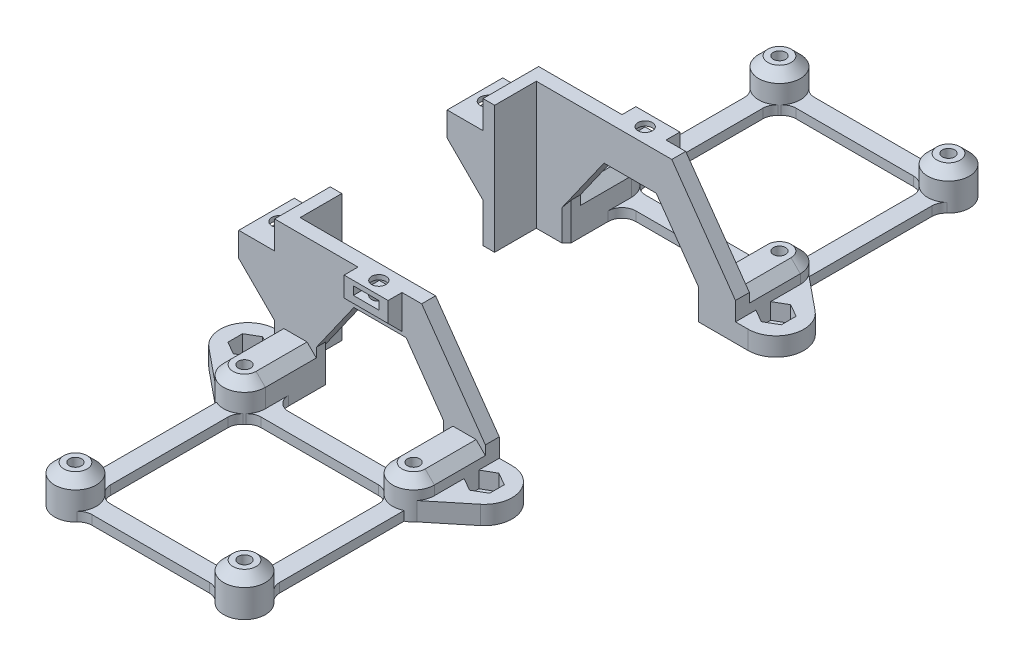
from build123d import *

# Parameters (mm, degrees)
SKETCH1_R             = 4.5
SKETCH1_R_2           = 1.325
BOSS_EXTRUDE1_DEPTH   = 8
BOSS_EXTRUDE1_2_DEPTH = 8
BOSS_EXTRUDE1_3_DEPTH = 8
BOSS_EXTRUDE1_4_DEPTH = 8
BOSS_EXTRUDE2_REACH   = 94.814
SKETCH2_W             = 3
SKETCH2_H             = 27.5
CUT_EXTRUDE1_DEPTH    = 64.069901696
SKETCH4_W             = 40.5
SKETCH4_H             = 40.5
SKETCH4_W_2           = 32.5
SKETCH4_H_2           = 32.5
BOSS_EXTRUDE3_DEPTH   = 2
SKETCH7_W             = 9.5
SKETCH7_H             = 3
BOSS_EXTRUDE5_DEPTH   = 4.3
CUT_EXTRUDE3_START    = -1
SKETCH8_W             = 5.5
SKETCH8_H             = 5.5
CUT_EXTRUDE3_DEPTH    = 1.8
CHAMFER3_SIZE         = 3
SKETCH9_R             = 1.55
CUT_EXTRUDE4_DEPTH    = 5.4
BOSS_EXTRUDE6_DEPTH   = 4
SKETCH11_R            = 1.5
BOSS_EXTRUDE7_DEPTH   = 0.5
FILLET2_R             = 3
CHAMFER4_SIZE         = 1
SKETCH12_W            = 2.5
SKETCH12_H            = 27.5
BOSS_EXTRUDE8_DEPTH   = 9
CHAMFER5_SIZE         = 2
SKETCH13_W            = 7.75
SKETCH13_H            = 12
BOSS_EXTRUDE9_DEPTH   = 5
CUT_EXTRUDE5_START    = -1
SKETCH14_W            = 5.5
SKETCH14_H            = 5.5
CUT_EXTRUDE5_DEPTH    = 1.8
CHAMFER6_SIZE         = 8
CHAMFER7_SIZE         = 8
SKETCH15_R            = 1.6
CUT_EXTRUDE6_DEPTH    = 12
SKETCH17_W            = 5.5
SKETCH17_H            = 1.8
CUT_EXTRUDE8_DEPTH    = 5.6
SKETCH18_W            = 5.5
SKETCH18_H            = 1.8
CUT_EXTRUDE9_DEPTH    = 5.6
SKETCH19_W            = 5.5
SKETCH19_H            = 1.8
CUT_EXTRUDE10_DEPTH   = 5.6
SKETCH20_W            = 5.5
SKETCH20_H            = 1.8
CUT_EXTRUDE11_DEPTH   = 5.6


# Some blends are built 0.0001 mm under size
with BuildPart() as part:
    # Sketch1 → Boss-Extrude1 (new body)
    with BuildSketch(Plane(origin=(0, 0, 0), x_dir=(1, 0, 0), z_dir=(0, 1, 0))):
        with Locations(Location((18.25, -76, 0), (0, 0, 270))):
            Circle(SKETCH1_R)
        with Locations(Location((18.25, -76, 0), (0, 0, 270))):
            Circle(SKETCH1_R_2, mode=Mode.SUBTRACT)
    extrude(amount=BOSS_EXTRUDE1_DEPTH)



with BuildPart() as body_2:
    # Sketch1 → Boss-Extrude1 2 (new body)
    with BuildSketch(Plane(origin=(0, 0, 0), x_dir=(1, 0, 0), z_dir=(0, 1, 0))):
        with Locations(Location((-18.25, -76, 0), (0, 0, 270))):
            Circle(SKETCH1_R)
        with Locations(Location((-18.25, -76, 0), (0, 0, 270))):
            Circle(SKETCH1_R_2, mode=Mode.SUBTRACT)
    extrude(amount=BOSS_EXTRUDE1_2_DEPTH)


with BuildPart() as body_3:
    # Sketch1 → Boss-Extrude1 3 (new body)
    with BuildSketch(Plane(origin=(0, 0, 0), x_dir=(1, 0, 0), z_dir=(0, 1, 0))):
        with BuildLine():
            Line((-22.75, -39.5), (-22.75, -25.5))
            Line((-22.75, -25.5), (-13.75, -25.5))
            Line((-13.75, -25.5), (-13.75, -39.5))
            ThreePointArc((-13.75, -39.5), (-18.25, -44), (-22.75, -39.5))
        make_face()
        with Locations(Location((-18.25, -39.5, 0), (0, 0, 270))):
            Circle(SKETCH1_R_2, mode=Mode.SUBTRACT)
    extrude(amount=BOSS_EXTRUDE1_3_DEPTH)

    # Boss-Extrude2: up to this face of the body (flat: up to its plane)
    boss_extrude2_end = Plane(body_3.part.faces().sort_by_distance((-22.75, 4, 32.5))[0])
    # Sketch2 → Boss-Extrude2 (add, up to the picked face)
    with BuildSketch(Plane(origin=(22.75, 0, 0), x_dir=(0, 0, -1), z_dir=(1, 0, 0)), mode=Mode.PRIVATE) as boss_extrude2_sk1:
        with Locations((-27, 13.75)):
            Rectangle(SKETCH2_W, SKETCH2_H)
    boss_extrude2_tool1 = split(extrude(boss_extrude2_sk1.sketch, amount=-BOSS_EXTRUDE2_REACH, mode=Mode.PRIVATE), bisect_by=boss_extrude2_end, keep=Keep.BOTH, mode=Mode.PRIVATE)


with BuildPart() as body_4:
    # Sketch1 → Boss-Extrude1 4 (new body)
    with BuildSketch(Plane(origin=(0, 0, 0), x_dir=(1, 0, 0), z_dir=(0, 1, 0))):
        with BuildLine():
            Line((22.75, -39.5), (22.75, -25.5))
            Line((22.75, -25.5), (13.75, -25.5))
            Line((13.75, -25.5), (13.75, -39.5))
            ThreePointArc((13.75, -39.5), (18.25, -44), (22.75, -39.5))
        make_face()
        with Locations(Location((18.25, -39.5, 0), (0, 0, 270))):
            Circle(SKETCH1_R_2, mode=Mode.SUBTRACT)
    extrude(amount=BOSS_EXTRUDE1_4_DEPTH)


with BuildPart() as body_3_1:
    add(body_3.part)

    add(body_4.part)  # Boss-Extrude2 merges body 4
    add(boss_extrude2_tool1.solids().sort_by(Axis((22.75, 13.75, 27), (-1, 0, 0)))[0])

    # Sketch3 → Cut-Extrude1 (cut, through all)
    with BuildSketch(Plane.XY.offset(28.5)):
        Polygon((9, 27.5), (22.75, 8), (22.75, 27.5), align=None)
        Polygon((-13.75, 8), (-13.75, 0), (13.75, 0), (13.75, 8), (5.641025641, 19.5), (-5.641025641, 19.5), align=None)
    extrude(amount=-CUT_EXTRUDE1_DEPTH, mode=Mode.SUBTRACT)


with BuildPart() as part_1:
    add(part.part)

    add(body_2.part)  # Boss-Extrude3 merges body 2

    add(body_3_1.part)  # Boss-Extrude3 merges body 3
    # Sketch4 → Boss-Extrude3 (add)
    with BuildSketch(Plane.XZ):
        with Locations((0, 57.75)):
            Rectangle(SKETCH4_W, SKETCH4_H)
        with Locations((0, 57.75)):
            Rectangle(SKETCH4_W_2, SKETCH4_H_2, mode=Mode.SUBTRACT)
    extrude(amount=-BOSS_EXTRUDE3_DEPTH)

    # Sketch7 → Boss-Extrude5 (add)
    with BuildSketch(Plane(origin=(0, 27.5, 0), x_dir=(1, 0, 0), z_dir=(0, 1, 0))):
        with Locations((0, -30)):
            Rectangle(SKETCH7_W, SKETCH7_H)
    extrude(amount=-BOSS_EXTRUDE5_DEPTH)

    # Sketch8 → Cut-Extrude3 (cut)
    with BuildSketch(Plane(origin=(0, 27.5, 0), x_dir=(1, 0, 0), z_dir=(0, 1, 0)).offset(CUT_EXTRUDE3_START)):
        with Locations((0, -28.75)):
            Rectangle(SKETCH8_W, SKETCH8_H)
    extrude(amount=-CUT_EXTRUDE3_DEPTH, mode=Mode.SUBTRACT)

    # Chamfer3
    chamfer3_edges = [part_1.edges().sort_by_distance(p)[0] for p in [
        (0, 23.2, 28.5),
    ]]
    chamfer(chamfer3_edges, length=CHAMFER3_SIZE - 0.0001)  # a hair under: the kernel refuses the full size

    # Sketch9 → Cut-Extrude4 (cut)
    with BuildSketch(Plane(origin=(0, 27.5, 0), x_dir=(1, 0, 0), z_dir=(0, 1, 0))):
        with Locations(Location((0, -28.75, 0), (0, 0, 270))):
            Circle(SKETCH9_R)
    extrude(amount=-CUT_EXTRUDE4_DEPTH, mode=Mode.SUBTRACT)

    # Sketch10 → Boss-Extrude6 (add)
    with BuildSketch(Plane.XZ):
        with BuildLine():
            Line((-22.75, 25.5), (-25.5, 25.5))
            ThreePointArc((-25.5, 25.5), (-31.151887406, 29.486006765), (-29.294287667, 36.14794375))
            Line((-29.294287667, 36.14794375), (-20.25, 43.531128874))
            Line((-20.25, 43.531128874), (-20.25, 25.5))
            Line((-20.25, 25.5), (-22.75, 25.5))
        make_face()
        Polygon((-25.5, 28.324573519), (-22.75, 29.91228676), (-22.75, 33.08771324), (-25.5, 34.675426481), (-28.25, 33.08771324), (-28.25, 29.91228676), align=None, mode=Mode.SUBTRACT)
    boss_extrude6 = extrude(amount=-BOSS_EXTRUDE6_DEPTH)

    # Sketch11 → Boss-Extrude7 (add)
    with BuildSketch(Plane.XZ):
        Polygon((-28.25, 33.08771324), (-28.25, 29.91228676), (-25.5, 28.324573519), (-22.75, 29.91228676), (-22.75, 33.08771324), (-25.5, 34.675426481), align=None)
        with Locations(Location((-25.5, 31.5, 0), (0, 0, 270))):
            Circle(SKETCH11_R, mode=Mode.SUBTRACT)
    boss_extrude7 = extrude(amount=-BOSS_EXTRUDE7_DEPTH)

    # Mirror1: Boss-Extrude6, Boss-Extrude7 across plane
    add(boss_extrude6.mirror(Plane(origin=(0, 0, 0), x_dir=(0, 0, 1), z_dir=(1, 0, 0))))
    add(boss_extrude7.mirror(Plane(origin=(0, 0, 0), x_dir=(0, 0, 1), z_dir=(1, 0, 0))))

    # Fillet2
    fillet2_edges = [part_1.edges().sort_by_distance(p)[0] for p in [
        (14.218871126, 1, 78),
        (-16.25, 1, 71.968871126),
        (-14.218871126, 1, 78),
        (-20.25, 1, 71.968871126),
        (-14.218871126, 1, 74),
        (14.218871126, 1, 41.5),
        (-14.218871126, 1, 41.5),
        (13.75, 1, 37.5),
        (-13.75, 1, 37.5),
        (16.25, 1, 71.968871126),
        (-16.25, 1, 43.531128874),
        (20.25, 1, 71.968871126),
        (16.25, 1, 43.531128874),
        (14.218871126, 1, 74),
    ]]
    fillet(fillet2_edges, radius=FILLET2_R)

    # Chamfer4
    chamfer4_edges = [part_1.edges().sort_by_distance(p)[0] for p in [
        (13.75, 4, 25.5),
        (-13.75, 4, 25.5),
    ]]
    chamfer(chamfer4_edges, length=CHAMFER4_SIZE)

    # Sketch12 → Boss-Extrude8 (add)
    with BuildSketch(Plane(origin=(0, 0, 25.5), x_dir=(-1, 0, 0), z_dir=(0, 0, -1))):
        with Locations((21.5, 13.75)):
            Rectangle(SKETCH12_W, SKETCH12_H)
    extrude(amount=BOSS_EXTRUDE8_DEPTH)

    # Chamfer5
    chamfer5_edges = [part_1.edges().sort_by_distance(p)[0] for p in [
        (18.25, 8, 71.5),
        (-18.25, 8, 71.5),
        (-22.75, 8, 34),
        (-18.25, 8, 44),
        (-13.75, 8, 34),
        (13.75, 8, 34),
        (18.25, 8, 44),
        (22.75, 8, 34),
    ]]
    chamfer(chamfer5_edges, length=CHAMFER5_SIZE)


with BuildPart() as body_2_2:
    # Mirror3: mirrored copy
    add(part_1.part.mirror(Plane.XY))


with BuildPart() as part_2:
    add(part_1.part)

    add(body_2_2.part)  # Boss-Extrude9 merges body 2 2
    # Sketch13 → Boss-Extrude9 (add)
    with BuildSketch(Plane(origin=(0, 21.5, 0), x_dir=(1, 0, 0), z_dir=(0, 1, 0))):
        with Locations((-26.625, -22.5)):
            Rectangle(SKETCH13_W, SKETCH13_H)
        with Locations((-26.625, 22.5)):
            Rectangle(SKETCH13_W, SKETCH13_H)
    extrude(amount=-BOSS_EXTRUDE9_DEPTH)

    # Sketch14 → Cut-Extrude5 (cut)
    with BuildSketch(Plane(origin=(0, 21.5, 0), x_dir=(1, 0, 0), z_dir=(0, 1, 0)).offset(CUT_EXTRUDE5_START)):
        with Locations((-27.75, 22.5)):
            Rectangle(SKETCH14_W, SKETCH14_H)
        with Locations((-27.75, -22.5)):
            Rectangle(SKETCH14_W, SKETCH14_H)
    extrude(amount=-CUT_EXTRUDE5_DEPTH, mode=Mode.SUBTRACT)

    # Chamfer6
    # the kernel refuses this chamfer: 8 mm, written as the material it adds along each edge
    with BuildSketch(Plane(origin=(-22.75, 16.5, 28.5), x_dir=(0.02749587661058606, -0.9996219169112968, 0), z_dir=(0, 0, -1))) as chamfer6_piece_1_section:
        Polygon((CHAMFER6_SIZE * 0.999621916911, CHAMFER6_SIZE * 0.0274958766106), (-CHAMFER6_SIZE * 0.0274958766106, CHAMFER6_SIZE * 0.999621916911), (0, 0), align=None)
    chamfer6_piece_1 = extrude(amount=12, mode=Mode.PRIVATE)
    chamfer6_piece_1 = split(chamfer6_piece_1, bisect_by=Plane(origin=(-30.5, 13.847270976, 22.5), z_dir=(1, 0, 0)), keep=Keep.TOP, mode=Mode.PRIVATE)
    add(chamfer6_piece_1)

    # Chamfer7
    # the kernel refuses this chamfer: 8 mm, written as the material it adds along each edge
    with BuildSketch(Plane(origin=(-22.75, 16.5, -28.5), x_dir=(-0.9996219169112968, 0.027495876610586487, 0), z_dir=(0, 0, 1))) as chamfer7_piece_1_section:
        Polygon((CHAMFER7_SIZE * 0.999621916911, CHAMFER7_SIZE * 0.0274958766106), (-CHAMFER7_SIZE * 0.0274958766106, CHAMFER7_SIZE * 0.999621916911), (0, 0), align=None)
    chamfer7_piece_1 = extrude(amount=12, mode=Mode.PRIVATE)
    chamfer7_piece_1 = split(chamfer7_piece_1, bisect_by=Plane(origin=(-30.5, 13.847270976, -22.5), z_dir=(1, 0, 0)), keep=Keep.TOP, mode=Mode.PRIVATE)
    add(chamfer7_piece_1)

    # Sketch15 → Cut-Extrude6 (cut)
    with BuildSketch(Plane(origin=(0, 21.5, 0), x_dir=(1, 0, 0), z_dir=(0, 1, 0))):
        with Locations(Location((-27.75, -22.5, 0), (0, 0, 270))):
            Circle(SKETCH15_R)
        with Locations(Location((-27.75, 22.5, 0), (0, 0, 270))):
            Circle(SKETCH15_R)
    extrude(amount=-CUT_EXTRUDE6_DEPTH, mode=Mode.SUBTRACT)

    # Sketch17 → Cut-Extrude8 (cut)
    with BuildSketch(Plane.XY.offset(31.5)):
        with Locations((0, 25.6)):
            Rectangle(SKETCH17_W, SKETCH17_H)
    extrude(amount=-CUT_EXTRUDE8_DEPTH, mode=Mode.SUBTRACT)

    # Sketch18 → Cut-Extrude9 (cut)
    with BuildSketch(Plane.ZY.offset(30.5)):
        with Locations((22.5, 19.6)):
            Rectangle(SKETCH18_W, SKETCH18_H)
    extrude(amount=-CUT_EXTRUDE9_DEPTH, mode=Mode.SUBTRACT)

    # Sketch19 → Cut-Extrude10 (cut)
    with BuildSketch(Plane.ZY.offset(30.5)):
        with Locations((-22.5, 19.6)):
            Rectangle(SKETCH19_W, SKETCH19_H)
    extrude(amount=-CUT_EXTRUDE10_DEPTH, mode=Mode.SUBTRACT)

    # Sketch20 → Cut-Extrude11 (cut)
    with BuildSketch(Plane(origin=(0, 0, -31.5), x_dir=(-1, 0, 0), z_dir=(0, 0, -1))):
        with Locations((0, 25.6)):
            Rectangle(SKETCH20_W, SKETCH20_H)
    extrude(amount=-CUT_EXTRUDE11_DEPTH, mode=Mode.SUBTRACT)


solid = part_2.part
